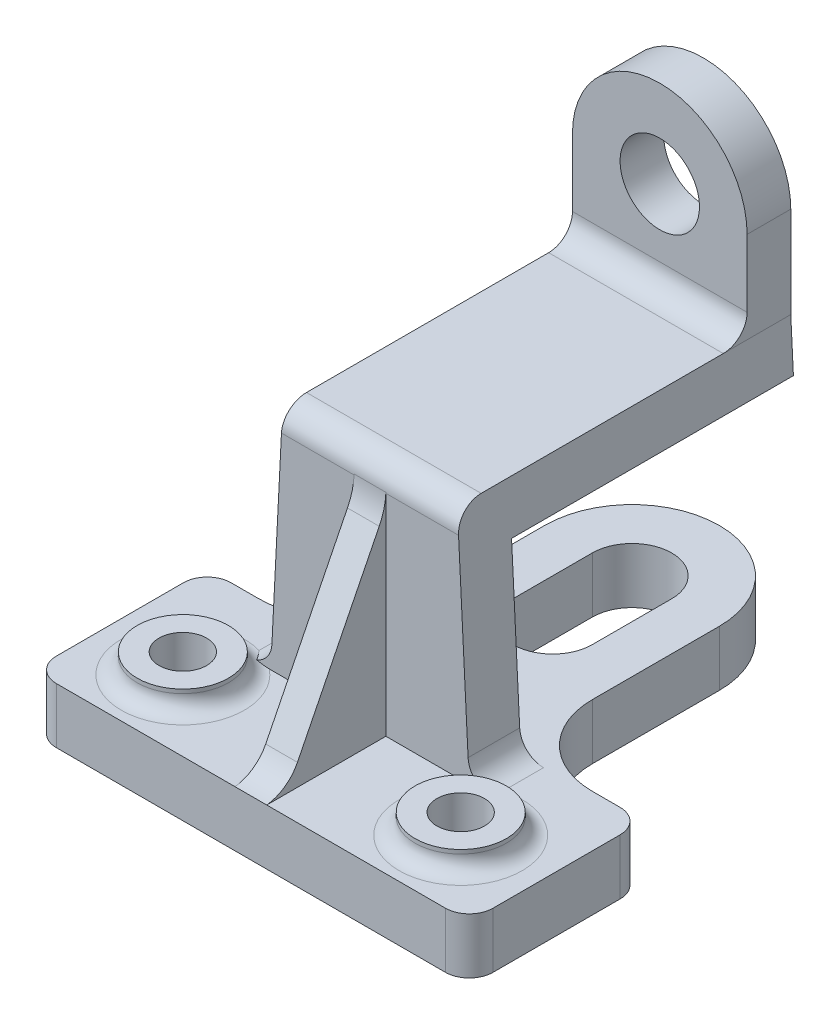
from build123d import *

# Parameters (mm, degrees)
ESTRUSIONE_ESTRUSIONE2_DEPTH = 55
NERVATURA1_REACH             = 177.707
SCHIZZO2_WALL_W              = 409.315984862
SCHIZZO2_WALL_H              = 4
SCHIZZO3_W                   = 84
SCHIZZO3_H                   = 104
TAGLIO_ESTRUSIONE1_DEPTH     = 30
SCHIZZO4_W                   = 74
SCHIZZO4_H                   = 14
TAGLIO_ESTRUSIONE2_DEPTH     = 33
SPECCHIA2_START              = -77
SPECCHIA2_DEPTH              = 22
SPECCHIA2_START_2            = -110
SPECCHIA2_2_OUTLINE_W        = 14
SPECCHIA2_2_OUTLINE_H        = 44
SPECCHIA2_2_DEPTH            = 33
SPECCHIA2_START_3            = -80
SPECCHIA2_3_DEPTH            = 3
SPECCHIA2_START_4            = -59
SPECCHIA2_4_DEPTH            = 4
RACCORDO1_RADIUS             = 22
RACCORDO1_LENGTH             = 14
RACCORDO3_R                  = 20
RACCORDO4_R                  = 6
TAGLIO_ESTRUSIONE3_DEPTH     = 184.760713973
SCHIZZO7_W                   = 3
SCHIZZO7_H                   = 45
TAGLIO_ESTRUSIONE4_DEPTH     = 192.397492147
RACCORDO11_RADIUS            = 22
RACCORDO11_LENGTH            = 11
RACCORDO12_R                 = 6
RACCORDO13_R                 = 16
RACCORDO15_R                 = 10
SCHIZZO8_R                   = 10
TAGLIO_ESTRUSIONE5_DEPTH     = 192.397492147
SCHIZZO9_R                   = 11.5
ESTRUSIONE_ESTRUSIONE3_DEPTH = 5
SCHIZZO10_R                  = 6
TAGLIO_ESTRUSIONE6_DEPTH     = 190.274932307
TAGLIO_ESTRUSIONE7_REACH     = 201.87
RACCORDO17_R                 = 4
RACCORDO18_START             = 75
RACCORDO18_DEPTH             = 13


with BuildPart() as part:
    # Schizzo1 → Estrusione-Estrusione2 (new body)
    with BuildSketch(Plane(origin=(0, 0, 0), x_dir=(0, 0, -1), z_dir=(1, 0, 0))):
        Polygon((0, 0), (-118, 0), (-118, 14), (-88, 14), (-88, 73), (-15, 73), (-15, 118), (-4, 118), (-4, 60), (-75, 60), (-75, 14), (0, 14), align=None)
    extrude(amount=-ESTRUSIONE_ESTRUSIONE2_DEPTH)

    # Schizzo2 wall → Nervatura1 (add, up to next)
    with BuildSketch(Plane(origin=(-55, 39, 100.5), x_dir=(0, -0.894427191, 0.4472135955), z_dir=(0, 0.4472135955, 0.894427191)), mode=Mode.PRIVATE) as nervatura1_sk1:
        with Locations((0, 2)):
            Rectangle(SCHIZZO2_WALL_W, SCHIZZO2_WALL_H)
    nervatura1_tool1 = extrude(nervatura1_sk1.sketch, amount=-NERVATURA1_REACH, mode=Mode.PRIVATE) - part.part
    add(nervatura1_tool1.solids().sort_by_distance((-55, 39, 100.5))[0])

    # Schizzo3 → Taglio-Estrusione1 (cut)
    with BuildSketch(Plane(origin=(0, 0, 0), x_dir=(0, 0, -1), z_dir=(1, 0, 0))):
        with Locations((-46, 66)):
            Rectangle(SCHIZZO3_W, SCHIZZO3_H)
    extrude(amount=-TAGLIO_ESTRUSIONE1_DEPTH, mode=Mode.SUBTRACT)

    # Schizzo4 → Taglio-Estrusione2 (cut)
    with BuildSketch(Plane(origin=(0, 0, 0), x_dir=(0, 0, -1), z_dir=(1, 0, 0))):
        with Locations((-37, 7)):
            Rectangle(SCHIZZO4_W, SCHIZZO4_H)
    extrude(amount=-TAGLIO_ESTRUSIONE2_DEPTH, mode=Mode.SUBTRACT)

    # Specchia2: read off the stored shape, not the designer's step
    # Specchia2 outline → Specchia2 (add)
    with BuildSketch(Plane.YZ.offset(SPECCHIA2_START)):
        Polygon((0, 0), (14, 0), (14, 75), (60, 75), (60, 4), (118, 4), (118, 15), (73, 15), (73, 88), (14, 88), (14, 118), (0, 118), align=None)
    extrude(amount=SPECCHIA2_DEPTH)

    # Specchia2 2 outline → Specchia2 2 (add)
    with BuildSketch(Plane.YZ.offset(SPECCHIA2_START_2)):
        with Locations((7, 96)):
            Rectangle(SPECCHIA2_2_OUTLINE_W, SPECCHIA2_2_OUTLINE_H)
    extrude(amount=SPECCHIA2_2_DEPTH)

    # Specchia2 3 outline → Specchia2 3 (add)
    with BuildSketch(Plane.YZ.offset(SPECCHIA2_START_3)):
        Polygon((14, 88), (14, 75), (60, 75), (60, 4), (118, 4), (118, 15), (73, 15), (73, 88), align=None)
    extrude(amount=SPECCHIA2_3_DEPTH)

    # Specchia2 4 outline → Specchia2 4 (add)
    with BuildSketch(Plane.YZ.offset(SPECCHIA2_START_4)):
        Polygon((14, 113), (14, 88), (64, 88), align=None)
    extrude(amount=SPECCHIA2_4_DEPTH)

    # Raccordo1: full round fillet: the end face becomes a half cylinder, R = half its width
    raccordo1_face = Plane((-55, 7, 0), x_dir=(0, -1, 0), z_dir=(0, 0, -1))  # on the end face: x along it, z out of the body
    raccordo1_slab = raccordo1_face.offset(-RACCORDO1_RADIUS / 2) * Box(RACCORDO1_LENGTH, 2 * RACCORDO1_RADIUS, RACCORDO1_RADIUS, mode=Mode.PRIVATE)  # the body's end, R deep
    raccordo1_round = Plane((-55, 7, 22), x_dir=(0, 0, -1), z_dir=(0, -1, 0)) * Cylinder(RACCORDO1_RADIUS, RACCORDO1_LENGTH, mode=Mode.PRIVATE)  # its axis R under the face
    add(raccordo1_slab - raccordo1_round, mode=Mode.SUBTRACT)

    # Raccordo3
    raccordo3_edges = [part.edges().sort_by_distance(p)[0] for p in [
        (-33, 7, 74),
        (-77, 7, 74),
    ]]
    fillet(raccordo3_edges, radius=RACCORDO3_R)

    # Raccordo4
    raccordo4_edges = [part.edges().sort_by_distance(p)[0] for p in [
        (0, 7, 74),
        (-110, 7, 118),
        (0, 7, 118),
        (-110, 7, 74),
    ]]
    fillet(raccordo4_edges, radius=RACCORDO4_R)

    # Schizzo6 → Taglio-Estrusione3 (cut, through all)
    with BuildSketch(Plane.XY.offset(88)):
        Polygon((-33, 73), (-30, 14), (-30, 73), align=None)
        Polygon((-80, 14), (-80, 73), (-77, 73), align=None)
    extrude(amount=-TAGLIO_ESTRUSIONE3_DEPTH, mode=Mode.SUBTRACT)

    # Schizzo7 → Taglio-Estrusione4 (cut, through all)
    with BuildSketch(Plane.XY.offset(15)):
        with Locations((-31.5, 95.5)):
            Rectangle(SCHIZZO7_W, SCHIZZO7_H)
        with Locations((-78.5, 95.5)):
            Rectangle(SCHIZZO7_W, SCHIZZO7_H)
    extrude(amount=-TAGLIO_ESTRUSIONE4_DEPTH, mode=Mode.SUBTRACT)

    # Raccordo11: full round fillet: the end face becomes a half cylinder, R = half its width
    raccordo11_face = Plane((-55, 118, 9.5), x_dir=(0, 0, -1), z_dir=(0, 1, 0))  # on the end face: x along it, z out of the body
    raccordo11_slab = raccordo11_face.offset(-RACCORDO11_RADIUS / 2) * Box(RACCORDO11_LENGTH, 2 * RACCORDO11_RADIUS, RACCORDO11_RADIUS, mode=Mode.PRIVATE)  # the body's end, R deep
    raccordo11_round = Plane((-55, 96, 9.5), x_dir=(0, 1, 0), z_dir=(0, 0, -1)) * Cylinder(RACCORDO11_RADIUS, RACCORDO11_LENGTH, mode=Mode.PRIVATE)  # its axis R under the face
    add(raccordo11_slab - raccordo11_round, mode=Mode.SUBTRACT)

    # Raccordo12
    raccordo12_edges = [part.edges().sort_by_distance(p)[0] for p in [
        (-55, 73, 15),
        (-55, 73, 88),
    ]]
    fillet(raccordo12_edges, radius=RACCORDO12_R)

    # Raccordo13
    # the kernel refuses this fillet: 16 mm, written as the material it adds along each edge
    with BuildSketch(Plane(origin=(-59, 64, 88), x_dir=(7.107647619401389e-15, 0.9999992149494827, -0.0012530364791798036), z_dir=(1, 0, 0))) as raccordo13_piece_1:
        with BuildLine():
            CenterArc((3.78664302, 15.989963147), RACCORDO13_R, 243.506742544, 24.463710432)
            Line((-3.350836892, 1.670173327), (-4.064584883, 0.238194345))
            Line((-4.064584883, 0.238194345), (-0.713747991, -1.431978982))
            Line((-0.713747991, -1.431978982), (0.002004858, -1.599998744))
            ThreePointArc((0.002004858, -1.599998744), (3.002002503, -1.596239634), (3.163341295, -1.598996315))
            Line((3.163341295, -1.598996315), (3.220005088, 0))
        make_face()
    extrude(amount=8)

    # Raccordo15
    # the kernel refuses this fillet: 10 mm, written as the material it adds along each edge
    with BuildSketch(Plane(origin=(-51, 14, 113), x_dir=(0, 0, 1), z_dir=(-1, 0, 0))) as raccordo15_piece_1:
        with BuildLine():
            CenterArc((6.217538244, 9.925603288), RACCORDO15_R, 206.565051177, 56.441617235)
            Line((-2.726733666, 5.453467333), (-2.905619105, 5.364024614))
            Line((-2.905619105, 5.364024614), (-0.178885438, -0.089442719))
            Line((-0.178885438, -0.089442719), (0, -0.2))
            ThreePointArc((0, -0.2), (2.5, -0.2), (4.975649235, -0.198512066))
            Line((4.975649235, -0.198512066), (5, 0))
        make_face()
    extrude(amount=8)

    # Schizzo8 → Taglio-Estrusione5 (cut, through all)
    with BuildSketch(Plane.XY.offset(15)):
        with Locations((-55, 96)):
            Circle(SCHIZZO8_R)
    extrude(amount=-TAGLIO_ESTRUSIONE5_DEPTH, mode=Mode.SUBTRACT)

    # Schizzo9 → Estrusione-Estrusione3 (add)
    with BuildSketch(Plane(origin=(0, 14, 0), x_dir=(1, 0, 0), z_dir=(0, 1, 0))):
        with Locations(Location((-90, -100.149267902, 0), (0, 0, 270))):
            Circle(SCHIZZO9_R)
        with Locations(Location((-20, -100.149267902, 0), (0, 0, 270))):
            Circle(SCHIZZO9_R)
    extrude(amount=ESTRUSIONE_ESTRUSIONE3_DEPTH)

    # Schizzo10 → Taglio-Estrusione6 (cut, through all)
    with BuildSketch(Plane(origin=(0, 19, 0), x_dir=(1, 0, 0), z_dir=(0, 1, 0))):
        with Locations(Location((-90, -100.149267902, 0), (0, 0, 270))):
            Circle(SCHIZZO10_R)
        with Locations(Location((-20, -100.149267902, 0), (0, 0, 270))):
            Circle(SCHIZZO10_R)
    extrude(amount=-TAGLIO_ESTRUSIONE6_DEPTH, mode=Mode.SUBTRACT)

    # Schizzo11 → Taglio-Estrusione7 (cut, up to next)
    with BuildSketch(Plane.XZ, mode=Mode.PRIVATE) as taglio_estrusione7_sk1:
        with BuildLine():
            Line((-65, 22), (-65, 42))
            ThreePointArc((-65, 42), (-55, 52), (-45, 42))
            Line((-45, 42), (-45, 22))
            ThreePointArc((-45, 22), (-55, 12), (-65, 22))
        make_face()
    taglio_estrusione7_tool1 = extrude(taglio_estrusione7_sk1.sketch, amount=-TAGLIO_ESTRUSIONE7_REACH, mode=Mode.PRIVATE) & part.part
    add(taglio_estrusione7_tool1.solids().sort_by_distance((-55, 0, 32))[0], mode=Mode.SUBTRACT)

    # Raccordo17
    raccordo17_edges = [part.edges().sort_by_distance(p)[0] for p in [
        (-90, 14, 88.649267902),
        (-20, 14, 88.649267902),
    ]]
    fillet(raccordo17_edges, radius=RACCORDO17_R)

    # Raccordo18: read off the stored shape, not the designer's step
    # Raccordo18 outline → Raccordo18 (add)
    with BuildSketch(Plane.XY.offset(RACCORDO18_START)):
        with BuildLine():
            Line((-80, 14), (-79.710408023, 19.695308884))
            ThreePointArc((-79.710408023, 19.695308884), (-81.56915401, 15.650968689), (-85.702666639, 14))
            Line((-85.702666639, 14), (-80, 14))
        make_face()
        with BuildLine():
            Line((-30.289591977, 19.695308884), (-30, 14))
            Line((-30, 14), (-24.297333361, 14))
            ThreePointArc((-24.297333361, 14), (-28.43084599, 15.650968689), (-30.289591977, 19.695308884))
        make_face()
    extrude(amount=RACCORDO18_DEPTH)


solid = part.part
